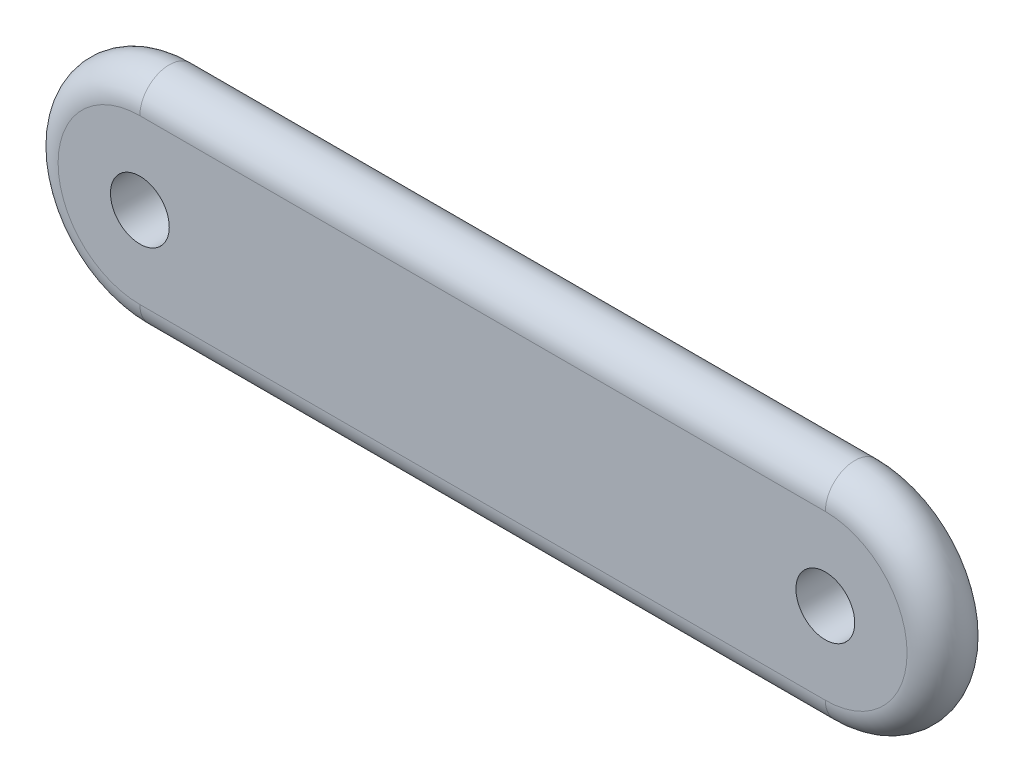
from build123d import *

# Parameters (mm, degrees)
BOSS_EXTRUDE1_DEPTH         = 6.35
F_1_4_0_25_DIAMETER_HOLE1_D = 6.35
FILLET1_R                   = 3.175


with BuildPart() as part:
    # Sketch1 → Boss-Extrude1 (new body)
    with BuildSketch(Plane.XY):
        with BuildLine():
            Line((-37.000000041, 11.999999876), (37.000000041, 11.999999876))
            ThreePointArc((37.000000041, 11.999999876), (48.999999917, 0), (37.000000041, -11.999999876))
            Line((37.000000041, -11.999999876), (-37.000000041, -11.999999876))
            ThreePointArc((-37.000000041, -11.999999876), (-48.999999917, 0), (-37.000000041, 11.999999876))
        make_face()
    extrude(amount=BOSS_EXTRUDE1_DEPTH)

    # 1/4 (0.25) Diameter Hole1 (through all)
    with Locations(Plane.XY.offset(6.35)):
        with Locations((-37.000000041, 0), (37.000000041, 0)):
            Hole(F_1_4_0_25_DIAMETER_HOLE1_D / 2)

    # Fillet1
    fillet1_edges = [part.edges().sort_by_distance(p)[0] for p in [
        (48.999999917, 0, 6.35),
        (0, 11.999999876, 6.35),
        (-48.999999917, 0, 6.35),
        (0, 11.999999876, 0),
        (0, -11.999999876, 0),
        (0, -11.999999876, 6.35),
    ]]
    fillet(fillet1_edges, radius=FILLET1_R - 0.0001)  # a hair under: the kernel refuses the full size


solid = part.part
